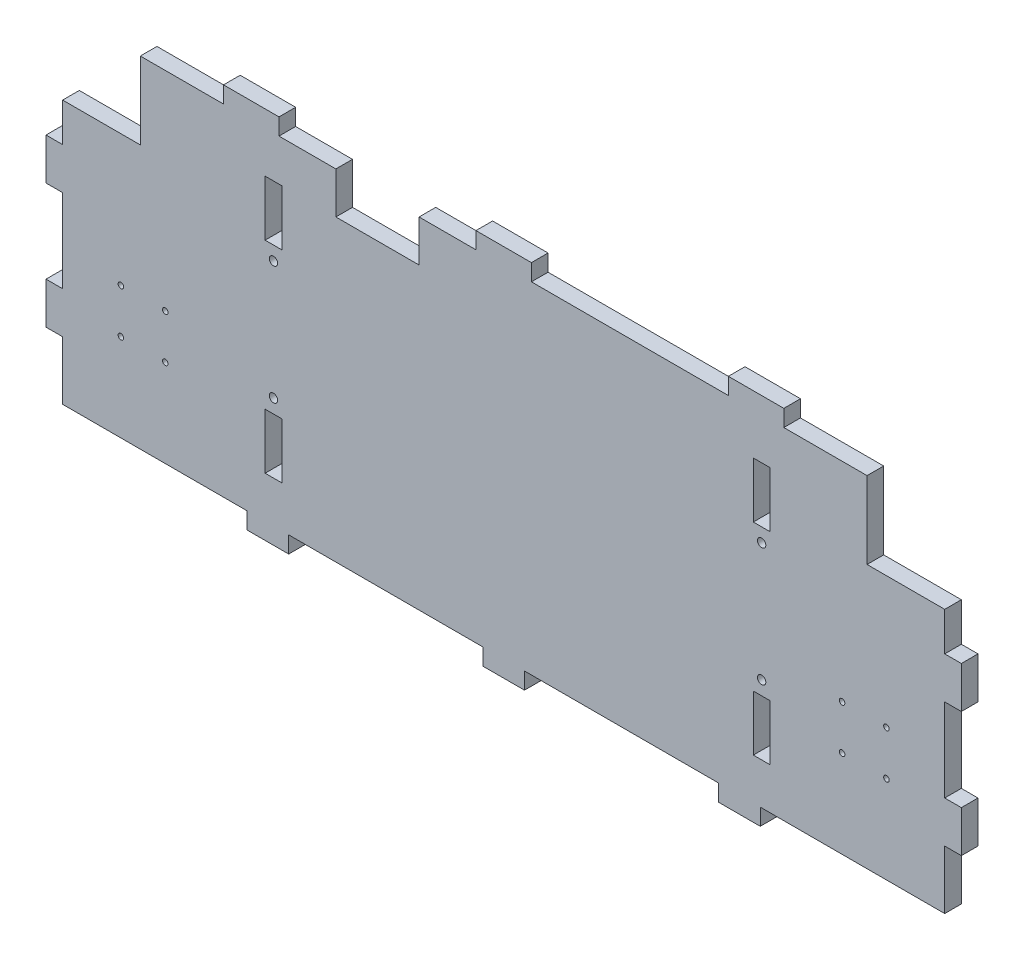
from build123d import *

# Parameters (mm, degrees)
ESQUISSE1_W             = 6
ESQUISSE1_H             = 20
BOSS_EXTRU_1_DEPTH      = 6
ESQUISSE2_W             = 15
ESQUISSE2_H             = 6
ESQUISSE2_W_2           = 6
ESQUISSE2_H_2           = 15
ESQUISSE2_W_3           = 20
BOSS_EXTRU_2_DEPTH      = 6
ESQUISSE3_R             = 1
ESQUISSE3_R_2           = 1.5
ENL_V_MAT_EXTRU_1_DEPTH = 6
ESQUISSE4_W             = 30
ESQUISSE4_H             = 15
ENL_V_MAT_EXTRU_2_DEPTH = 6


with BuildPart() as part:
    # Esquisse1 → Boss.-Extru.1 (new body)
    with BuildSketch(Plane.XY):
        Polygon((-159, 35), (-131, 35), (-131, 62.75), (131, 62.75), (131, 35), (159, 35), (159, -60), (-159, -60), align=None)
        with Locations((93, 37.75)):
            Rectangle(ESQUISSE1_W, ESQUISSE1_H, mode=Mode.SUBTRACT)
        with Locations((93, -35.01)):
            Rectangle(ESQUISSE1_W, ESQUISSE1_H, mode=Mode.SUBTRACT)
        with Locations((-83, 37.75)):
            Rectangle(ESQUISSE1_W, ESQUISSE1_H, mode=Mode.SUBTRACT)
        with Locations((-83, -35.01)):
            Rectangle(ESQUISSE1_W, ESQUISSE1_H, mode=Mode.SUBTRACT)
    extrude(amount=BOSS_EXTRU_1_DEPTH)

    # Esquisse2 → Boss.-Extru.2 (add)
    with BuildSketch(Plane.XY.offset(6)):
        with Locations((-85, -63)):
            Rectangle(ESQUISSE2_W, ESQUISSE2_H)
        with Locations((0, -63)):
            Rectangle(ESQUISSE2_W, ESQUISSE2_H)
        with Locations((85, -63)):
            Rectangle(ESQUISSE2_W, ESQUISSE2_H)
        with Locations((-162, 13.59)):
            Rectangle(ESQUISSE2_W_2, ESQUISSE2_H_2)
        with Locations((-162, -31.41)):
            Rectangle(ESQUISSE2_W_2, ESQUISSE2_H_2)
        with Locations((162, -31.41)):
            Rectangle(ESQUISSE2_W_2, ESQUISSE2_H_2)
        with Locations((162, 13.59)):
            Rectangle(ESQUISSE2_W_2, ESQUISSE2_H_2)
        with Locations((91, 65.75)):
            Rectangle(ESQUISSE2_W_3, ESQUISSE2_H)
        with Locations((-91, 65.75)):
            Rectangle(ESQUISSE2_W_3, ESQUISSE2_H)
        with Locations((0, 65.75)):
            Rectangle(ESQUISSE2_W_3, ESQUISSE2_H)
    extrude(amount=-BOSS_EXTRU_2_DEPTH)

    # Esquisse3 → Enlèv. mat.-Extru.1 (cut)
    with BuildSketch(Plane(origin=(0, 0, 0), x_dir=(-1, 0, 0), z_dir=(0, 0, -1))):
        with Locations((138, -28.38)):
            Circle(ESQUISSE3_R)
        with Locations((138, -12.38)):
            Circle(ESQUISSE3_R)
        with Locations((122, -12.38)):
            Circle(ESQUISSE3_R)
        with Locations((122, -28.38)):
            Circle(ESQUISSE3_R)
        with Locations((-122, -28.38)):
            Circle(ESQUISSE3_R)
        with Locations((-122, -12.38)):
            Circle(ESQUISSE3_R)
        with Locations((-138, -12.38)):
            Circle(ESQUISSE3_R)
        with Locations((-138, -28.38)):
            Circle(ESQUISSE3_R)
        with Locations((83, 22.75)):
            Circle(ESQUISSE3_R_2)
        with Locations((83, -20.01)):
            Circle(ESQUISSE3_R_2)
        with Locations((-93, 22.75)):
            Circle(ESQUISSE3_R_2)
        with Locations((-93, -20.01)):
            Circle(ESQUISSE3_R_2)
    extrude(amount=-ENL_V_MAT_EXTRU_1_DEPTH, mode=Mode.SUBTRACT)

    # Esquisse4 → Enlèv. mat.-Extru.2 (cut)
    with BuildSketch(Plane(origin=(0, 0, 0), x_dir=(-1, 0, 0), z_dir=(0, 0, -1))):
        with Locations((45.5, 55.25)):
            Rectangle(ESQUISSE4_W, ESQUISSE4_H)
    extrude(amount=-ENL_V_MAT_EXTRU_2_DEPTH, mode=Mode.SUBTRACT)


solid = part.part
